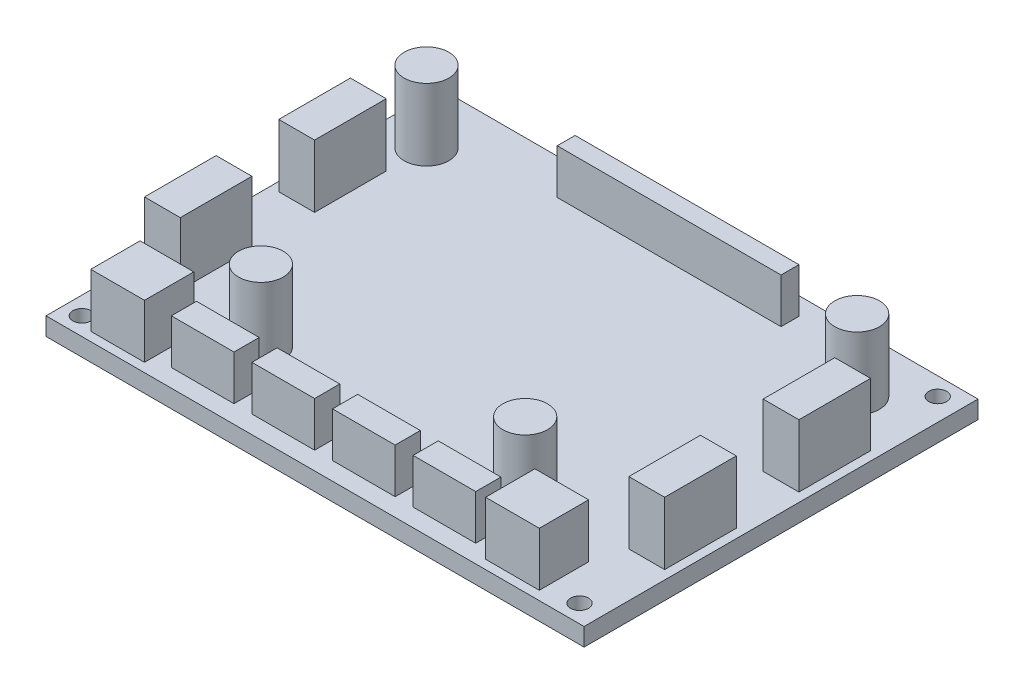
from build123d import *

# Parameters (mm, degrees)
SKETCH1_W           = 95.40875
SKETCH1_H           = 69.85
BOSS_EXTRUDE1_DEPTH = 3.175
SKETCH1_4_R         = 3.96875
BOSS_EXTRUDE2_DEPTH = 15.875
SKETCH1_5_W         = 6.35
SKETCH1_5_H         = 12.7
BOSS_EXTRUDE3_DEPTH = 14.2875
SKETCH1_6_W         = 39.6875
SKETCH1_6_H         = 3.175
BOSS_EXTRUDE4_DEPTH = 11.1125
SKETCH1_8_R         = 1.5875
CUT_EXTRUDE4_DEPTH  = 104.830931221
SKETCH1_9_W         = 11.1125
SKETCH1_9_H         = 4.464487979
BOSS_EXTRUDE5_DEPTH = 11.1125
SKETCH1_10_W        = 9.525
SKETCH1_10_H        = 8.739789678
BOSS_EXTRUDE6_DEPTH = 12.7


with BuildPart() as part:
    # Sketch1 → Boss-Extrude1 (new body)
    with BuildSketch(Plane(origin=(0, 0, 0), x_dir=(1, 0, 0), z_dir=(0, 1, 0))):
        with Locations((-27.460937167, 34.925)):
            Rectangle(SKETCH1_W, SKETCH1_H)
    extrude(amount=BOSS_EXTRUDE1_DEPTH)

    # Sketch1<4> → Boss-Extrude2 (add)
    with BuildSketch(Plane(origin=(0, 0, 0), x_dir=(1, 0, 0), z_dir=(0, 1, 0))):
        with Locations((-51.352812167, 14.2875)):
            Circle(SKETCH1_4_R)
        with Locations((-4.486033595, 14.2875)):
            Circle(SKETCH1_4_R)
        with Locations((9.130937833, 59.53125)):
            Circle(SKETCH1_4_R)
        with Locations((-67.227812167, 59.53125)):
            Circle(SKETCH1_4_R)
    extrude(amount=BOSS_EXTRUDE2_DEPTH)

    # Sketch1<5> → Boss-Extrude3 (add)
    with BuildSketch(Plane(origin=(0, 0, 0), x_dir=(1, 0, 0), z_dir=(0, 1, 0))):
        with Locations((-70.402812167, 46.0375)):
            Rectangle(SKETCH1_5_W, SKETCH1_5_H)
        with Locations((-70.402812167, 22.225)):
            Rectangle(SKETCH1_5_W, SKETCH1_5_H)
        with Locations((15.480937833, 22.225)):
            Rectangle(SKETCH1_5_W, SKETCH1_5_H)
        with Locations((15.480937833, 46.0375)):
            Rectangle(SKETCH1_5_W, SKETCH1_5_H)
    extrude(amount=BOSS_EXTRUDE3_DEPTH)

    # Sketch1<6> → Boss-Extrude4 (add)
    with BuildSketch(Plane(origin=(0, 0, 0), x_dir=(1, 0, 0), z_dir=(0, 1, 0))):
        with Locations((-28.175312167, 65.0875)):
            Rectangle(SKETCH1_6_W, SKETCH1_6_H)
    extrude(amount=BOSS_EXTRUDE4_DEPTH)

    # Sketch1<8> → Cut-Extrude4 (cut, through all)
    with BuildSketch(Plane(origin=(0, 0, 0), x_dir=(1, 0, 0), z_dir=(0, 1, 0))):
        with Locations((-71.990312167, 66.675)):
            Circle(SKETCH1_8_R)
        with Locations((16.274687833, 3.175)):
            Circle(SKETCH1_8_R)
        with Locations((16.274687833, 66.675)):
            Circle(SKETCH1_8_R)
        with Locations((-71.990312167, 3.175)):
            Circle(SKETCH1_8_R)
    extrude(amount=CUT_EXTRUDE4_DEPTH, mode=Mode.SUBTRACT)

    # Sketch1<9> → Boss-Extrude5 (add)
    with BuildSketch(Plane(origin=(0, 0, 0), x_dir=(1, 0, 0), z_dir=(0, 1, 0))):
        with Locations((-36.271562167, 5.40724399)):
            Rectangle(SKETCH1_9_W, SKETCH1_9_H)
        with Locations((-50.559062167, 5.40724399)):
            Rectangle(SKETCH1_9_W, SKETCH1_9_H)
        with Locations((-21.984062167, 5.40724399)):
            Rectangle(SKETCH1_9_W, SKETCH1_9_H)
        with Locations((-7.696562167, 5.40724399)):
            Rectangle(SKETCH1_9_W, SKETCH1_9_H)
    extrude(amount=BOSS_EXTRUDE5_DEPTH)

    # Sketch1<10> → Boss-Extrude6 (add)
    with BuildSketch(Plane(origin=(0, 0, 0), x_dir=(1, 0, 0), z_dir=(0, 1, 0))):
        with Locations((-64.052812167, 5.957394839)):
            Rectangle(SKETCH1_10_W, SKETCH1_10_H)
        with Locations((5.955937833, 5.957394839)):
            Rectangle(SKETCH1_10_W, SKETCH1_10_H)
    extrude(amount=BOSS_EXTRUDE6_DEPTH)


solid = part.part
